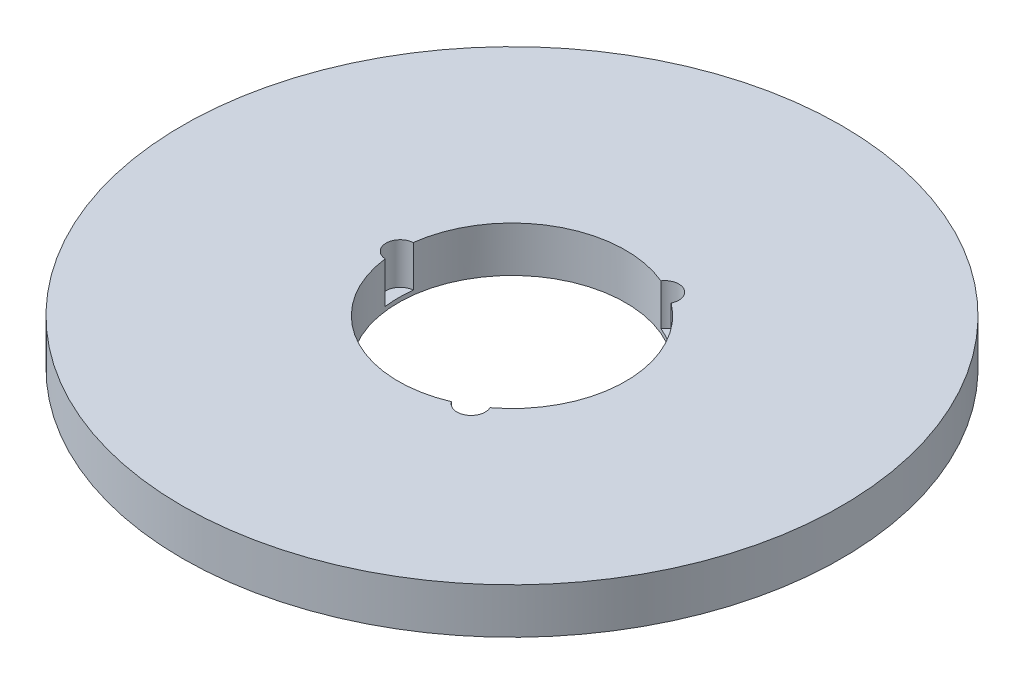
from build123d import *

# Parameters (mm, degrees)
SKETCH1_R           = 72.5
BOSS_EXTRUDE1_DEPTH = 10
SKETCH2_R           = 25
CUT_EXTRUDE1_DEPTH  = 104.01698889
SKETCH3_R           = 3.107386095
CUT_EXTRUDE2_DEPTH  = 9.075080167
CIRPATTERN1_COUNT   = 3


with BuildPart() as part:
    # Sketch1 → Boss-Extrude1 (new body)
    with BuildSketch(Plane(origin=(0, 0, 0), x_dir=(1, 0, 0), z_dir=(0, 1, 0))):
        Circle(SKETCH1_R)
    extrude(amount=BOSS_EXTRUDE1_DEPTH)

    # Sketch2 → Cut-Extrude1 (cut, through all)
    with BuildSketch(Plane(origin=(0, 0, 0), x_dir=(1, 0, 0), z_dir=(0, 1, 0))):
        Circle(SKETCH2_R)
    extrude(amount=CUT_EXTRUDE1_DEPTH, mode=Mode.SUBTRACT)

    # Sketch3 → Cut-Extrude2 (cut)
    with BuildSketch(Plane(origin=(0, 10, 0), x_dir=(1, 0, 0), z_dir=(0, 1, 0))):
        with Locations((-24.590236014, 0)):
            Circle(SKETCH3_R)
    cut_extrude2 = extrude(amount=-CUT_EXTRUDE2_DEPTH, mode=Mode.SUBTRACT)

    # CirPattern1: Cut-Extrude2 ×3 about axis
    cirpattern1_axis = Axis((0, 0, 0), (0, 1, 0))
    for i in range(1, CIRPATTERN1_COUNT):
        add(cut_extrude2.rotate(cirpattern1_axis, i * 360 / CIRPATTERN1_COUNT), mode=Mode.SUBTRACT)


solid = part.part
